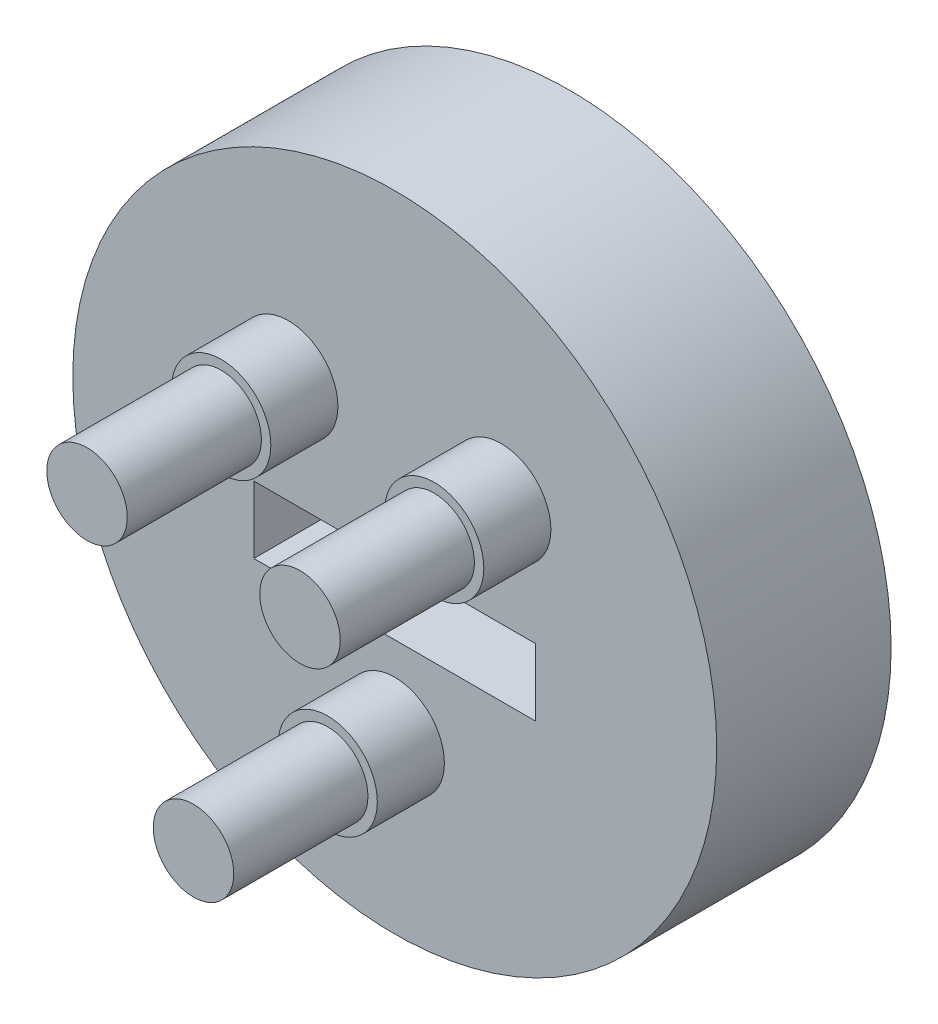
from build123d import *

# Parameters (mm, degrees)
SKETCH1_R      = 24
EXTRUDE1_DEPTH = 5
SKETCH2_R      = 24
EXTRUDE2_DEPTH = 8
SKETCH3_R      = 2.5
SKETCH3_R_2    = 3.7
EXTRUDE3_DEPTH = 5
SKETCH5_R      = 3
EXTRUDE6_DEPTH = 10
SKETCH6_R      = 3.175
EXTRUDE7_DEPTH = 3


with BuildPart() as part:
    # Sketch1 → Extrude1 (new body)
    with BuildSketch(Plane.XY):
        Circle(SKETCH1_R)
    extrude(amount=EXTRUDE1_DEPTH)

    # Sketch2 → Extrude2 (add)
    with BuildSketch(Plane.XY.offset(5)):
        Circle(SKETCH2_R)
        with BuildLine():
            Line((-2.5, 0), (-10.5, 0))
            Line((-10.5, 0), (-10.5, -5))
            Line((-10.5, -5), (10.5, -5))
            Line((10.5, -5), (10.5, 0))
            Line((10.5, 0), (2.5, 0))
            ThreePointArc((2.5, 0), (0, -2.5), (-2.5, 0))
        make_face(mode=Mode.SUBTRACT)
    extrude(amount=EXTRUDE2_DEPTH)

    # Sketch3 → Extrude3 (add)
    with BuildSketch(Plane.XY.offset(13)):
        Circle(SKETCH3_R)
        with Locations((-7.9375, 7.9375)):
            Circle(SKETCH3_R_2)
        with Locations((7.9375, 7.9375)):
            Circle(SKETCH3_R_2)
        with Locations((0, -11.1125)):
            Circle(SKETCH3_R_2)
    extrude(amount=EXTRUDE3_DEPTH)

    # Sketch5 → Extrude6 (add)
    with BuildSketch(Plane.XY.offset(18)):
        with Locations((-7.9375, 7.9375)):
            Circle(SKETCH5_R)
        with Locations((7.9375, 7.9375)):
            Circle(SKETCH5_R)
        with Locations((0, -11.1125)):
            Circle(SKETCH5_R)
    extrude(amount=EXTRUDE6_DEPTH)

    # Sketch6 → Extrude7 (cut)
    with BuildSketch(Plane(origin=(0, 0, 0), x_dir=(-1, 0, 0), z_dir=(0, 0, -1))):
        with Locations((0, 12.7)):
            Circle(SKETCH6_R)
        with Locations((7.9375, -11.1125)):
            Circle(SKETCH6_R)
        with Locations((-7.9375, -11.1125)):
            Circle(SKETCH6_R)
    extrude(amount=-EXTRUDE7_DEPTH, mode=Mode.SUBTRACT)


solid = part.part
